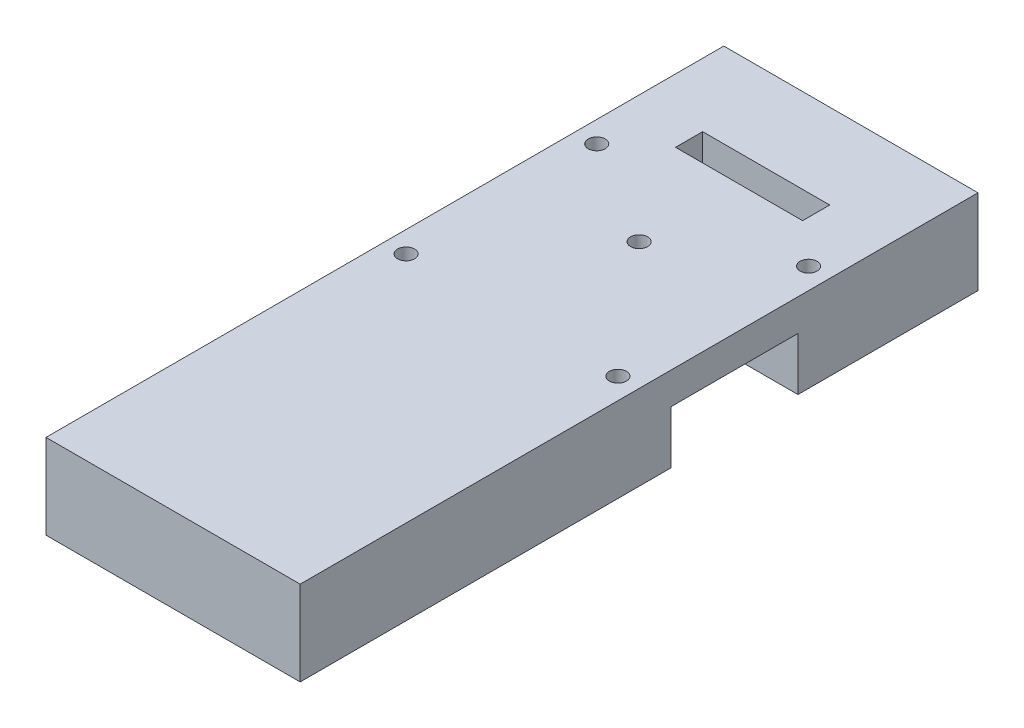
from build123d import *

# Parameters (mm, degrees)
BOSS_EXTRUDE1_DEPTH         = 12.7
BOSS_EXTRUDE1_DEPTH_BACK    = 12.7
SKETCH1_W                   = 76.2
SKETCH1_H                   = 203.2
SKETCH2_R                   = 4.7625
CUT_EXTRUDE1_DEPTH          = 25.4
CUT_EXTRUDE2_DEPTH          = 15.875
SKETCH5_W                   = 38.1
SKETCH5_H                   = 8.128
CUT_EXTRUDE4_DEPTH          = 110.249530891
F_1_4_20_TAPPED_HOLE1_D     = 5.1054
F_1_4_20_TAPPED_HOLE1_DEPTH = 19.05
F_1_4_20_TAPPED_HOLE1_TIP   = 1.533816902
SKETCH9_R                   = 2.5527
CUT_EXTRUDE5_DEPTH          = 112.44204772
CUT_EXTRUDE6_REACH          = 156.535


with BuildPart() as part:
    # Sketch1 → Boss-Extrude1 (new, two sides: drawn at the far end of the back side and taken through both)
    with BuildSketch(Plane(origin=(0, 0, 0), x_dir=(1, 0, 0), z_dir=(0, 1, 0)).offset(-BOSS_EXTRUDE1_DEPTH_BACK)):
        Rectangle(SKETCH1_W, SKETCH1_H)
    extrude(amount=BOSS_EXTRUDE1_DEPTH + BOSS_EXTRUDE1_DEPTH_BACK)

    # Sketch2 → Cut-Extrude1 (cut)
    with BuildSketch(Plane(origin=(0, 0, -101.6), x_dir=(-1, 0, 0), z_dir=(0, 0, -1))):
        with Locations((0, -12.7)):
            Circle(SKETCH2_R)
    extrude(amount=-CUT_EXTRUDE1_DEPTH, mode=Mode.SUBTRACT)

    # Sketch3 → Cut-Extrude2 (cut)
    with BuildSketch(Plane(origin=(0, -12.7, 0), x_dir=(-1, 0, 0), z_dir=(0, -1, 0))):
        with BuildLine():
            Line((-19.05, -96.8375), (19.05, -96.8375))
            ThreePointArc((19.05, -96.8375), (23.540128061, -94.977628061), (25.4, -90.4875))
            Line((25.4, -90.4875), (25.4, 9.525))
            Line((25.4, 9.525), (44.45, 9.525))
            Line((44.45, 9.525), (44.45, 47.625))
            Line((44.45, 47.625), (-44.45, 47.625))
            Line((-44.45, 47.625), (-44.45, 9.525))
            Line((-44.45, 9.525), (-25.4, 9.525))
            Line((-25.4, 9.525), (-25.4, -90.4875))
            ThreePointArc((-25.4, -90.4875), (-23.540128061, -94.977628061), (-19.05, -96.8375))
        make_face()
        with BuildLine():
            Line((-22.225, 76.2), (22.225, 76.2))
            ThreePointArc((22.225, 76.2), (24.47006403, 75.27006403), (25.4, 73.025))
            Line((25.4, 73.025), (25.4, 71.247))
            ThreePointArc((25.4, 71.247), (24.47006403, 69.00193597), (22.225, 68.072))
            Line((22.225, 68.072), (-22.225, 68.072))
            ThreePointArc((-22.225, 68.072), (-24.47006403, 69.00193597), (-25.4, 71.247))
            Line((-25.4, 71.247), (-25.4, 73.025))
            ThreePointArc((-25.4, 73.025), (-24.47006403, 75.27006403), (-22.225, 76.2))
        make_face()
    extrude(amount=-CUT_EXTRUDE2_DEPTH, mode=Mode.SUBTRACT)

    # Sketch5 → Cut-Extrude4 (cut, through all)
    with BuildSketch(Plane(origin=(0, 0, 0), x_dir=(1, 0, 0), z_dir=(0, 1, 0))):
        with Locations((0, 72.136)):
            Rectangle(SKETCH5_W, SKETCH5_H)
    extrude(amount=CUT_EXTRUDE4_DEPTH, mode=Mode.SUBTRACT)

    # 1/4-20 Tapped Hole1
    with Locations(Plane(origin=(-11.034450397, 12.7, 14.547513529), x_dir=(-1, 0, 0), z_dir=(0, 1, 0))):
        with Locations((-11.034450397, -52.647513529)):
            Hole(F_1_4_20_TAPPED_HOLE1_D / 2, depth=F_1_4_20_TAPPED_HOLE1_DEPTH)
            with Locations((0, 0, -(F_1_4_20_TAPPED_HOLE1_DEPTH + F_1_4_20_TAPPED_HOLE1_TIP / 2))):  # 118° drill point
                Cone(0, F_1_4_20_TAPPED_HOLE1_D / 2, F_1_4_20_TAPPED_HOLE1_TIP, mode=Mode.SUBTRACT)

    # Sketch9 → Cut-Extrude5 (cut, through all)
    with BuildSketch(Plane(origin=(0, -12.7, 0), x_dir=(-1, 0, 0), z_dir=(0, -1, 0))):
        with Locations((31.75, 57.15)):
            Circle(SKETCH9_R)
        with Locations((31.75, 0)):
            Circle(SKETCH9_R)
        with Locations((-31.75, 0)):
            Circle(SKETCH9_R)
        with Locations((-31.75, 57.15)):
            Circle(SKETCH9_R)
    extrude(amount=-CUT_EXTRUDE5_DEPTH, mode=Mode.SUBTRACT)

    # Sketch10 → Cut-Extrude6 (cut, up to next)
    with BuildSketch(Plane.XY.offset(-47.625), mode=Mode.PRIVATE) as cut_extrude6_sk1:
        with BuildLine():
            Line((-10.939706577, -10.414), (-12.209706577, -10.414))
            Line((-12.209706577, -10.414), (-12.209706577, -14.986))
            Line((-12.209706577, -14.986), (-10.939706577, -14.986))
            ThreePointArc((-10.939706577, -14.986), (0, -23.876), (10.939706577, -14.986))
            Line((10.939706577, -14.986), (12.209706577, -14.986))
            Line((12.209706577, -14.986), (12.209706577, -10.414))
            Line((12.209706577, -10.414), (10.939706577, -10.414))
            ThreePointArc((10.939706577, -10.414), (0, -1.524), (-10.939706577, -10.414))
        make_face()
    cut_extrude6_tool1 = extrude(cut_extrude6_sk1.sketch, amount=-CUT_EXTRUDE6_REACH, mode=Mode.PRIVATE) & part.part
    add(cut_extrude6_tool1.solids().sort_by_distance((0, -12.7, -47.625))[0], mode=Mode.SUBTRACT)


solid = part.part
